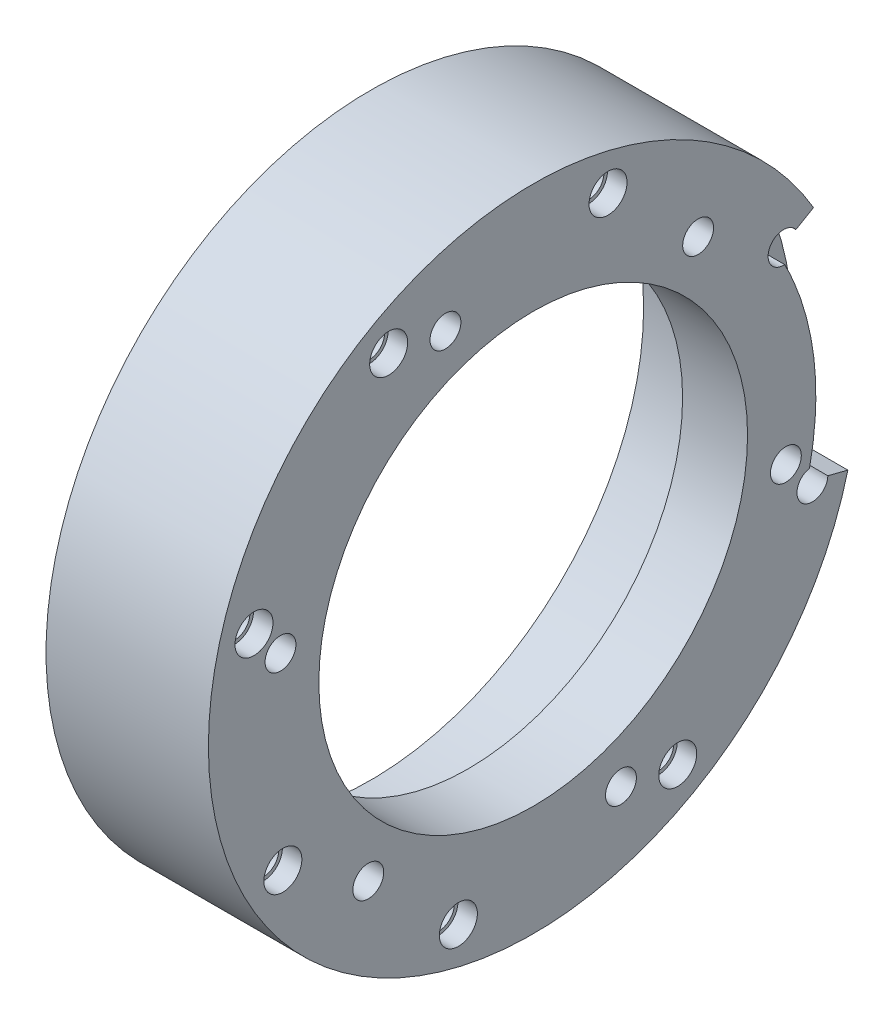
from build123d import *
from OCP.BRepAlgoAPI import BRepAlgoAPI_Cut
from OCP.TopTools import TopTools_ListOfShape

# Parameters (mm, degrees)
SKETCH1_R           = 50
SKETCH1_R_2         = 42
BOSS_EXTRUDE1_DEPTH = 15
SKETCH2_R           = 47.5
SKETCH2_R_2         = 33
BOSS_EXTRUDE2_DEPTH = 10
SKETCH4_R           = 1.575
CUT_EXTRUDE2_DEPTH  = 76
CIRPATTERN2_COUNT   = 8
SKETCH7_R           = 1.575
CUT_EXTRUDE3_DEPTH  = 76
CIRPATTERN3_COUNT   = 6
SKETCH17_R          = 2.375
CUT_EXTRUDE7_DEPTH  = 11.5
SKETCH18_R          = 2.375
SKETCH18_R_2        = 1.575
CUT_EXTRUDE8_DEPTH  = 6
CUT_EXTRUDE6_DEPTH  = 8
CUT_SWEEP1_START    = 21
CUT_SWEEP1_DEPTH    = 5
BOSS_EXTRUDE6_DEPTH = 10
SKETCH19_R          = 1.575
BOSS_EXTRUDE7_DEPTH = 13.5
CUT_EXTRUDE9_START  = -6
CUT_EXTRUDE9_DEPTH  = 6
SKETCH21_R          = 2.925
CUT_EXTRUDE10_DEPTH = 3


with BuildPart() as part:
    # Sketch1 → Boss-Extrude1 (new body)
    with BuildSketch(Plane(origin=(0, 0, 0), x_dir=(0, 0, -1), z_dir=(1, 0, 0))):
        Circle(SKETCH1_R)
        Circle(SKETCH1_R_2, mode=Mode.SUBTRACT)
    extrude(amount=BOSS_EXTRUDE1_DEPTH)

    # Sketch2 → Boss-Extrude2 (add)
    with BuildSketch(Plane(origin=(15, 0, 0), x_dir=(0, 0, -1), z_dir=(1, 0, 0))):
        Circle(SKETCH2_R)
        Circle(SKETCH2_R_2, mode=Mode.SUBTRACT)
    extrude(amount=BOSS_EXTRUDE2_DEPTH)

    # Sketch4 → Cut-Extrude2 (cut, through all)
    with BuildSketch(Plane.ZY):
        with Locations((-11.517447507, 42.98369927)):
            Circle(SKETCH4_R)
    cut_extrude2 = extrude(amount=-CUT_EXTRUDE2_DEPTH, mode=Mode.SUBTRACT)

    # CirPattern2: Cut-Extrude2 ×8 about axis
    cirpattern2_axis = Axis((0, 0, 0), (1, 0, 0))
    for i in range(1, CIRPATTERN2_COUNT):
        add(cut_extrude2.rotate(cirpattern2_axis, i * 360 / CIRPATTERN2_COUNT), mode=Mode.SUBTRACT)

    # Sketch7 → Cut-Extrude3 (cut, through all)
    with BuildSketch(Plane(origin=(25, 0, 0), x_dir=(0, 0, -1), z_dir=(1, 0, 0))):
        with Locations((-13.509795661, 37.117858521)):
            Circle(SKETCH7_R)
    cut_extrude3 = extrude(amount=-CUT_EXTRUDE3_DEPTH, mode=Mode.SUBTRACT)

    # CirPattern3: Cut-Extrude3 ×6 about axis
    cirpattern3_axis = Axis((0, 0, 0), (1, 0, 0))
    for i in range(1, CIRPATTERN3_COUNT):
        add(cut_extrude3.rotate(cirpattern3_axis, i * 360 / CIRPATTERN3_COUNT), mode=Mode.SUBTRACT)

    # Sketch17 → Cut-Extrude7 (cut)
    with BuildSketch(Plane(origin=(25, 0, 0), x_dir=(0, 0, -1), z_dir=(1, 0, 0))):
        with Locations((-42.98369927, 11.517447507)):
            Circle(SKETCH17_R)
        with Locations((-38.538130468, -22.25)):
            Circle(SKETCH17_R)
        with Locations((-11.517447507, -42.98369927)):
            Circle(SKETCH17_R)
        with Locations((22.25, -38.538130468)):
            Circle(SKETCH17_R)
        with Locations((42.98369927, -11.517447507)):
            Circle(SKETCH17_R)
        with Locations((38.538130468, 22.25)):
            Circle(SKETCH17_R)
        with Locations((11.517447507, 42.98369927)):
            Circle(SKETCH17_R)
        with Locations((-22.25, 38.538130468)):
            Circle(SKETCH17_R)
    extrude(amount=-CUT_EXTRUDE7_DEPTH, mode=Mode.SUBTRACT)

    # Sketch18 → Cut-Extrude8 (cut)
    # profile 1 of 6: a face of its own
    with BuildSketch(Plane(origin=(25, 0, 0), x_dir=(0, 0, -1), z_dir=(1, 0, 0))):
        with Locations((-38.899906244, 6.859103018)):
            Circle(SKETCH18_R)
        with Locations((-38.899906244, 6.859103018)):
            Circle(SKETCH18_R_2, mode=Mode.SUBTRACT)
    # profile 2 of 6: a face of its own
    with BuildSketch(Plane(origin=(25, 0, 0), x_dir=(0, 0, -1), z_dir=(1, 0, 0))):
        with Locations((-25.390110583, -30.258755503)):
            Circle(SKETCH18_R)
        with Locations((-25.390110583, -30.258755503)):
            Circle(SKETCH18_R_2, mode=Mode.SUBTRACT)
    # profile 3 of 6: a face of its own
    with BuildSketch(Plane(origin=(25, 0, 0), x_dir=(0, 0, -1), z_dir=(1, 0, 0))):
        with Locations((13.509795661, -37.117858521)):
            Circle(SKETCH18_R)
        with Locations((13.509795661, -37.117858521)):
            Circle(SKETCH18_R_2, mode=Mode.SUBTRACT)
    # profile 4 of 6: a face of its own
    with BuildSketch(Plane(origin=(25, 0, 0), x_dir=(0, 0, -1), z_dir=(1, 0, 0))):
        with Locations((38.899906244, -6.859103018)):
            Circle(SKETCH18_R)
        with Locations((38.899906244, -6.859103018)):
            Circle(SKETCH18_R_2, mode=Mode.SUBTRACT)
    # profile 5 of 6: a face of its own
    with BuildSketch(Plane(origin=(25, 0, 0), x_dir=(0, 0, -1), z_dir=(1, 0, 0))):
        with Locations((25.390110583, 30.258755503)):
            Circle(SKETCH18_R)
        with Locations((25.390110583, 30.258755503)):
            Circle(SKETCH18_R_2, mode=Mode.SUBTRACT)
    # profile 6 of 6: a face of its own
    with BuildSketch(Plane(origin=(25, 0, 0), x_dir=(0, 0, -1), z_dir=(1, 0, 0))):
        with Locations((-13.509795661, 37.117858521)):
            Circle(SKETCH18_R)
        with Locations((-13.509795661, 37.117858521)):
            Circle(SKETCH18_R_2, mode=Mode.SUBTRACT)
    extrude(amount=-CUT_EXTRUDE8_DEPTH, mode=Mode.SUBTRACT)

    # Sketch12 → Cut-Extrude6 (cut)
    with BuildSketch(Plane(origin=(25, 0, 0), x_dir=(0, 0, -1), z_dir=(1, 0, 0))):
        with BuildLine():
            ThreePointArc((39.732510194, 23.254656307), (45.589669783, 6.405733006), (44.602467407, -11.404880862))
            Line((44.602467407, -11.404880862), (46.019379893, -11.767186336))
            ThreePointArc((46.019379893, -11.767186336), (47.128391363, -5.929985459), (47.5, 0))
            ThreePointArc((47.5, 0), (45.84484162, 12.429822882), (40.994715921, 23.99340048))
            Line((40.994715921, 23.99340048), (39.732510194, 23.254656307))
        make_face()
        with BuildLine():
            ThreePointArc((47.5, 0), (47.128391363, -5.929985459), (46.019379893, -11.767186336))
            Line((46.019379893, -11.767186336), (47.508954558, -12.148071578))
            ThreePointArc((47.508954558, -12.148071578), (48.560487254, 6.82315791), (42.321650147, 24.770028969))
            Line((42.321650147, 24.770028969), (40.994715921, 23.99340048))
            ThreePointArc((40.994715921, 23.99340048), (45.84484162, 12.429822882), (47.5, 0))
        make_face()
        with BuildLine():
            ThreePointArc((44.909683958, -10.127768414), (44.760630743, -10.767420383), (44.602467407, -11.404880862))
            Line((44.602467407, -11.404880862), (45.357336181, -11.597901314))
            ThreePointArc((45.357336181, -11.597901314), (45.358358473, -11.557680184), (45.35869927, -11.517447507))
            ThreePointArc((45.35869927, -11.517447507), (45.243659295, -10.787238165), (44.909683958, -10.127768414))
        make_face()
        with BuildLine():
            ThreePointArc((39.732510194, 23.254656307), (40.255948718, 22.336293316), (40.758164235, 21.406154592))
            ThreePointArc((40.758164235, 21.406154592), (40.874067668, 21.821021677), (40.913130468, 22.25))
            ThreePointArc((40.913130468, 22.25), (40.792261739, 22.998008833), (40.441958077, 23.669882191))
            Line((40.441958077, 23.669882191), (39.732510194, 23.254656307))
        make_face()
    extrude(amount=-CUT_EXTRUDE6_DEPTH, mode=Mode.SUBTRACT)

    # Cut-Sweep1: read off the stored shape, not the designer's step
    # Cut-Sweep1 outline → Cut-Sweep1 (cut)
    with BuildSketch(Plane.YZ.offset(CUT_SWEEP1_START)):
        with BuildLine():
            add(Edge.make_bspline(
                [(-9.184742958, -42.537476808), (-6.896414636, -43.029008788), (-4.540142558, -43.338499502), (0.768286017, -43.602929952), (3.713391759, -43.460134373), (9.540403061, -42.562346065), (12.377455207, -41.823008905), (16.756379009, -40.201899634), (18.346135753, -39.498335389), (19.881187558, -38.709456514)],
                knots=[0.073720378, 0.073720378, 0.073720378, 0.073720378, 0.270688643, 0.270688643, 0.513792429, 0.513792429, 0.756896214, 0.756896214, 0.903534461, 0.903534461, 0.903534461, 0.903534461], degree=3))
            ThreePointArc((-9.184742958, -42.537476808), (-9.310441235, -43.861052286), (-10.127768414, -44.909683958))
            ThreePointArc((-10.127768414, -44.909683958), (6.009099575, -45.643642805), (21.406154592, -40.758164235))
            ThreePointArc((21.406154592, -40.758164235), (20.344850807, -39.95623891), (19.881187558, -38.709456514))
        make_face()
    extrude(amount=CUT_SWEEP1_DEPTH, mode=Mode.SUBTRACT)

    # Sketch16 → Boss-Extrude6 (add)
    with BuildSketch(Plane(origin=(15, 0, 0), x_dir=(0, 0, -1), z_dir=(1, 0, 0))):
        with BuildLine():
            Line((48.441452519, -12.386511932), (46.019379893, -11.767186336))
            ThreePointArc((46.019379893, -11.767186336), (-47.0379433, -6.609227646), (40.994715921, 23.99340048))
            Line((40.994715921, 23.99340048), (43.152332548, 25.256211031))
            ThreePointArc((43.152332548, 25.256211031), (-49.513624527, -6.957081733), (48.441452519, -12.386511932))
        make_face()
    extrude(amount=BOSS_EXTRUDE6_DEPTH)

    # Sketch19 → Boss-Extrude7 (add)
    with BuildSketch(Plane.ZY):
        with Locations((-38.538130468, 22.25)):
            Circle(SKETCH19_R)
        with Locations((-42.98369927, -11.517447507)):
            Circle(SKETCH19_R)
    extrude(amount=-BOSS_EXTRUDE7_DEPTH)


with BuildPart() as cut_extrude9_tool:
    # Cut-Extrude9: read off the stored shape, not the designer's step
    # Cut-Extrude9 outline → Cut-Extrude9 (new body)
    with BuildSketch(Plane(origin=(21, 0, 0), x_dir=(0, 0, -1), z_dir=(1, 0, 0)).offset(CUT_EXTRUDE9_START)):
        with BuildLine():
            add(Edge.make_bspline(
                [(38.709457577, 19.881185488), (40.428683332, 16.535803809), (41.544558093, 12.959160077), (42.103481625, 11.167677363), (42.505889448, 9.334971056), (42.90685332, 7.508841011), (43.147464222, 5.670640546), (43.627346092, 2.004476351), (43.47570998, -1.746290068), (43.399734773, -3.625560465), (43.165631914, -5.485281769), (42.929939197, -7.357632971), (42.537477197, -9.184741145)],
                knots=[0, 0, 0, 0.25, 0.25, 0.375, 0.375, 0.5, 0.5, 0.75, 0.75, 0.875, 0.875, 1, 1, 1], degree=2))
            ThreePointArc((42.537477197, -9.184741145), (44.527903199, -9.712992125), (45.357336181, -11.597901314))
            Line((45.357336181, -11.597901314), (46.019379893, -11.767186336))
            ThreePointArc((46.019379893, -11.767186336), (47.0379433, 6.609227646), (40.994715921, 23.99340048))
            Line((40.994715921, 23.99340048), (40.441958077, 23.669882191))
            ThreePointArc((40.441958077, 23.669882191), (40.698018948, 21.262322546), (38.709457577, 19.881185488))
        make_face()
    extrude(amount=CUT_EXTRUDE9_DEPTH)


with BuildPart() as part_1:
    add(part.part)

    # Cut-Extrude9: cut by cut_extrude9_tool, with a tolerance
    cut_extrude9_stock = TopTools_ListOfShape()
    cut_extrude9_stock.Append(part_1.part.wrapped)
    cut_extrude9_tools = TopTools_ListOfShape()
    cut_extrude9_tools.Append(cut_extrude9_tool.part.wrapped)
    cut_extrude9_cut = BRepAlgoAPI_Cut()
    cut_extrude9_cut.SetArguments(cut_extrude9_stock)
    cut_extrude9_cut.SetTools(cut_extrude9_tools)
    cut_extrude9_cut.SetFuzzyValue(0.00001)
    cut_extrude9_cut.Build()
    add(Compound.cast(cut_extrude9_cut.Shape()).solids(), mode=Mode.REPLACE)

    # Sketch21 → Cut-Extrude10 (cut)
    with BuildSketch(Plane(origin=(25, 0, 0), x_dir=(0, 0, -1), z_dir=(1, 0, 0))):
        with Locations((-42.98369927, 11.517447507)):
            Circle(SKETCH21_R)
        with Locations((-22.25, 38.538130468)):
            Circle(SKETCH21_R)
        with Locations((11.517447507, 42.98369927)):
            Circle(SKETCH21_R)
        with Locations((22.25, -38.538130468)):
            Circle(SKETCH21_R)
        with Locations((-11.517447507, -42.98369927)):
            Circle(SKETCH21_R)
        with Locations((-38.538130468, -22.25)):
            Circle(SKETCH21_R)
    extrude(amount=-CUT_EXTRUDE10_DEPTH, mode=Mode.SUBTRACT)


solid = part_1.part
